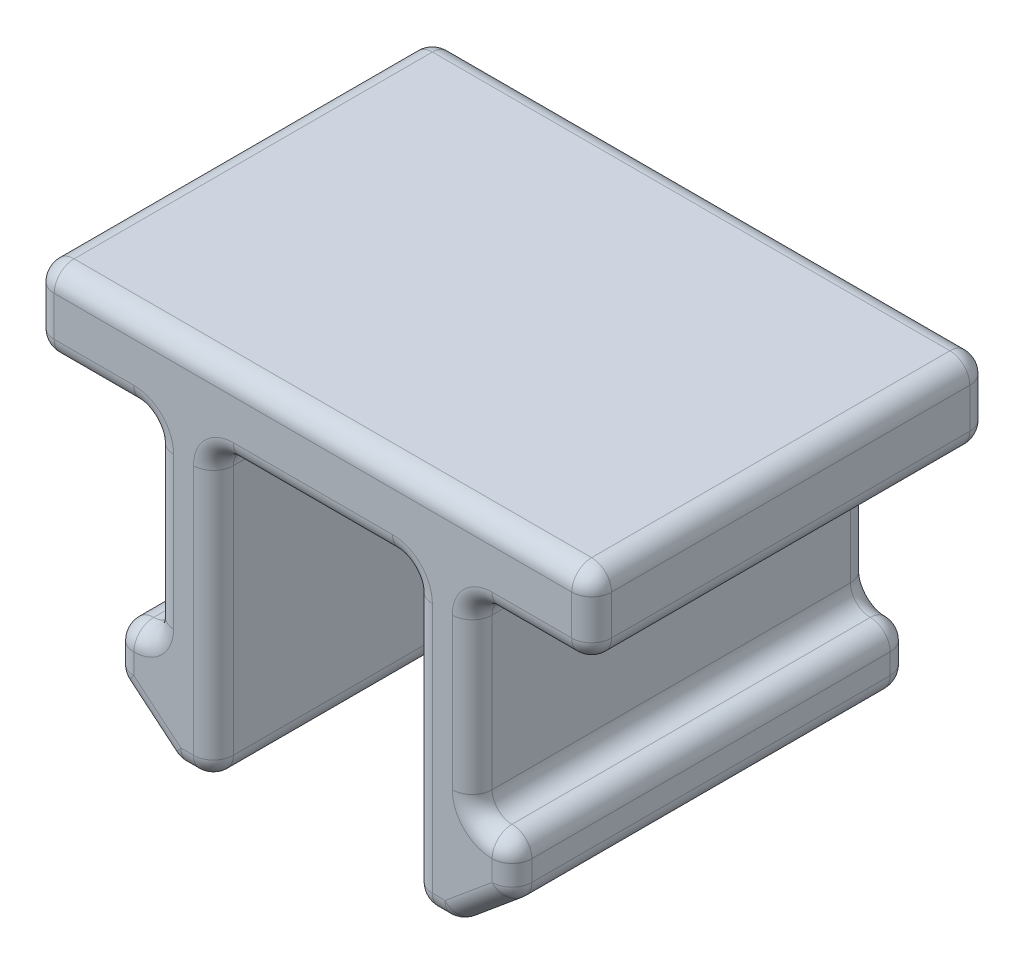
from build123d import *

# Parameters (mm, degrees)
EXTRUDE_1_DEPTH = 10
FILLET_1_R      = 0.5


with BuildPart() as part:
    # 草图1 → 凸台-拉伸1 (new body)
    with BuildSketch(Plane.XY):
        Polygon((28.798297288, 30.507736781), (42.798297288, 30.507736781), (42.798297288, 28.507736781), (39.798297288, 28.507736781), (39.798297288, 23.707736781), (40.798297288, 23.707736781), (40.798297288, 22.457736781), (39.298297288, 21.207736781), (38.298297288, 21.207736781), (38.298297288, 28.507736781), (33.298297288, 28.507736781), (33.298297288, 21.207736781), (32.298297288, 21.207736781), (30.798297288, 22.457736781), (30.798297288, 23.707736781), (31.798297288, 23.707736781), (31.798297288, 28.507736781), (28.798297288, 28.507736781), align=None)
    extrude(amount=EXTRUDE_1_DEPTH)

    # 圆角1
    fillet_1_edges = [part.edges().sort_by_distance(p)[0] for p in [
        (31.798297288, 26.107736781, 10),
        (31.298297288, 23.707736781, 10),
        (35.798297288, 30.507736781, 0),
        (42.798297288, 29.507736781, 0),
        (41.298297288, 28.507736781, 0),
        (39.798297288, 26.107736781, 0),
        (40.298297288, 23.707736781, 0),
        (40.798297288, 23.082736781, 0),
        (40.048297288, 21.832736781, 0),
        (38.798297288, 21.207736781, 0),
        (38.298297288, 24.857736781, 0),
        (30.798297288, 23.082736781, 10),
        (35.798297288, 28.507736781, 0),
        (33.298297288, 24.857736781, 0),
        (32.798297288, 21.207736781, 0),
        (31.548297288, 21.832736781, 0),
        (30.798297288, 23.082736781, 0),
        (31.298297288, 23.707736781, 0),
        (31.798297288, 26.107736781, 0),
        (30.298297288, 28.507736781, 0),
        (28.798297288, 29.507736781, 0),
        (31.548297288, 21.832736781, 10),
        (32.798297288, 21.207736781, 10),
        (28.798297288, 30.507736781, 5),
        (42.798297288, 30.507736781, 5),
        (42.798297288, 28.507736781, 5),
        (39.798297288, 28.507736781, 5),
        (39.798297288, 23.707736781, 5),
        (40.798297288, 23.707736781, 5),
        (40.798297288, 22.457736781, 5),
        (39.298297288, 21.207736781, 5),
        (38.298297288, 21.207736781, 5),
        (38.298297288, 28.507736781, 5),
        (33.298297288, 28.507736781, 5),
        (33.298297288, 21.207736781, 5),
        (32.298297288, 21.207736781, 5),
        (30.798297288, 22.457736781, 5),
        (30.798297288, 23.707736781, 5),
        (31.798297288, 23.707736781, 5),
        (31.798297288, 28.507736781, 5),
        (28.798297288, 28.507736781, 5),
        (33.298297288, 24.857736781, 10),
        (35.798297288, 28.507736781, 10),
        (38.298297288, 24.857736781, 10),
        (38.798297288, 21.207736781, 10),
        (40.048297288, 21.832736781, 10),
        (28.798297288, 29.507736781, 10),
        (40.798297288, 23.082736781, 10),
        (40.298297288, 23.707736781, 10),
        (39.798297288, 26.107736781, 10),
        (41.298297288, 28.507736781, 10),
        (42.798297288, 29.507736781, 10),
        (35.798297288, 30.507736781, 10),
        (30.298297288, 28.507736781, 10),
    ]]
    fillet(fillet_1_edges, radius=FILLET_1_R - 0.0001)  # a hair under: the kernel refuses the full size


solid = part.part
